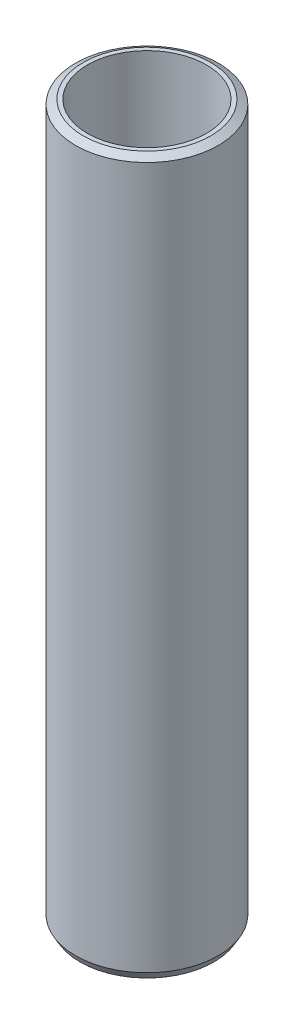
from build123d import *
from OCP.BRepFilletAPI import BRepFilletAPI_MakeChamfer

# Parameters (mm, degrees)
SKETCH1_R           = 60
BOSS_EXTRUDE1_DEPTH = 600
SKETCH2_R           = 49.995579652
CUT_EXTRUDE1_DEPTH  = 606.970296302
CHAMFER1_SIZE       = 3.732959833
CHAMFER1_SIZE2      = 6.465676093


with BuildPart() as part:
    # Sketch1 → Boss-Extrude1 (new body)
    with BuildSketch(Plane(origin=(0, 0, 0), x_dir=(1, 0, 0), z_dir=(0, 1, 0))):
        Circle(SKETCH1_R)
    extrude(amount=BOSS_EXTRUDE1_DEPTH)

    # Sketch2 → Cut-Extrude1 (cut, through all)
    with BuildSketch(Plane(origin=(0, 0, 0), x_dir=(1, 0, 0), z_dir=(0, 1, 0))):
        Circle(SKETCH2_R)
    extrude(amount=CUT_EXTRUDE1_DEPTH, mode=Mode.SUBTRACT)

    # Chamfer1: one chamfer whose edges measure the first distance from different faces: ONE call of the kernel's chamfer builder (chamfer() names one face for all edges)
    chamfer1_edges_1 = [part.edges().sort_by_distance(p)[0] for p in [
        (-60, 600, 0),
    ]]
    chamfer1_side_1 = [part.faces().sort_by_distance(p)[0] for p in [
        (-60, 300, 0),
    ]]
    chamfer1_edges_2 = [part.edges().sort_by_distance(p)[0] for p in [
        (-60, 0, 0),
    ]]
    chamfer1_side_2 = [part.faces().sort_by_distance(p)[0] for p in [
        (-58.302943725, 0, 0),
    ]]
    chamfer1 = BRepFilletAPI_MakeChamfer(part.part.solid().wrapped)
    for e in chamfer1_edges_1:
        chamfer1.Add(CHAMFER1_SIZE, CHAMFER1_SIZE2, e.wrapped, chamfer1_side_1[0].wrapped)  # the first distance lies on this face
    for e in chamfer1_edges_2:
        chamfer1.Add(CHAMFER1_SIZE, CHAMFER1_SIZE2, e.wrapped, chamfer1_side_2[0].wrapped)  # the first distance lies on this face
    add(Compound.cast(chamfer1.Shape()), mode=Mode.REPLACE)


solid = part.part
